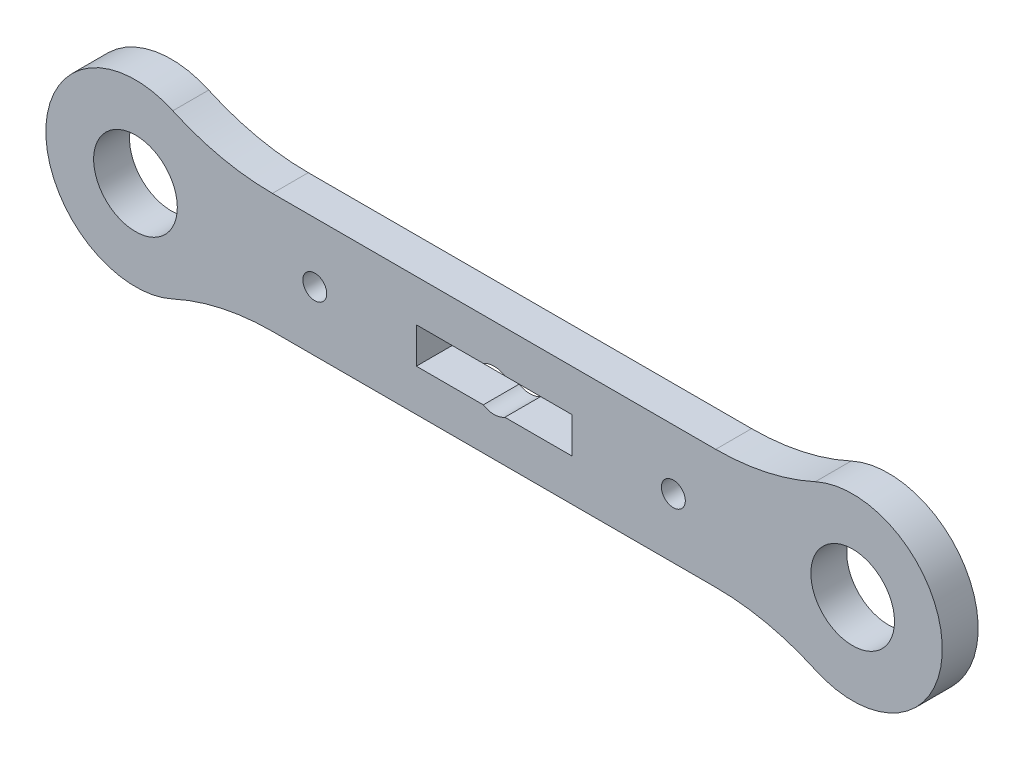
from build123d import *

# Parameters (mm, degrees)
ESBO_O1_R                = 3.5
ESBO_O1_R_2              = 1
RESSALTO_EXTRUS_O1_DEPTH = 3
FILETE1_R                = 20


with BuildPart() as part:
    # Esboço1 → Ressalto-extrusão1 (new body)
    with BuildSketch(Plane.XY):
        with BuildLine():
            ThreePointArc((5.590169944, 5), (-7.5, 0), (5.590169944, -5))
            Line((5.590169944, -5), (54.409830056, -5))
            ThreePointArc((54.409830056, -5), (67.5, 0), (54.409830056, 5))
            Line((54.409830056, 5), (5.590169944, 5))
        make_face()
        Circle(ESBO_O1_R, mode=Mode.SUBTRACT)
        with Locations((15, 0)):
            Circle(ESBO_O1_R_2, mode=Mode.SUBTRACT)
        with BuildLine():
            ThreePointArc((29.098612181, 1.5), (30, 1.75), (30.901387819, 1.5))
            Line((30.901387819, 1.5), (36.5, 1.5))
            Line((36.5, 1.5), (36.5, -1.5))
            Line((36.5, -1.5), (30.901387819, -1.5))
            ThreePointArc((30.901387819, -1.5), (30, -1.75), (29.098612181, -1.5))
            Line((29.098612181, -1.5), (23.5, -1.5))
            Line((23.5, -1.5), (23.5, 1.5))
            Line((23.5, 1.5), (29.098612181, 1.5))
        make_face(mode=Mode.SUBTRACT)
        with Locations((45, 0)):
            Circle(ESBO_O1_R_2, mode=Mode.SUBTRACT)
        with Locations((60, 0)):
            Circle(ESBO_O1_R, mode=Mode.SUBTRACT)
    extrude(amount=RESSALTO_EXTRUS_O1_DEPTH)

    # Filete1
    filete1_edges = [part.edges().sort_by_distance(p)[0] for p in [
        (5.590169944, -5, 1.5),
        (54.409830056, -5, 1.5),
        (54.409830056, 5, 1.5),
        (5.590169944, 5, 1.5),
    ]]
    fillet(filete1_edges, radius=FILETE1_R)


solid = part.part
